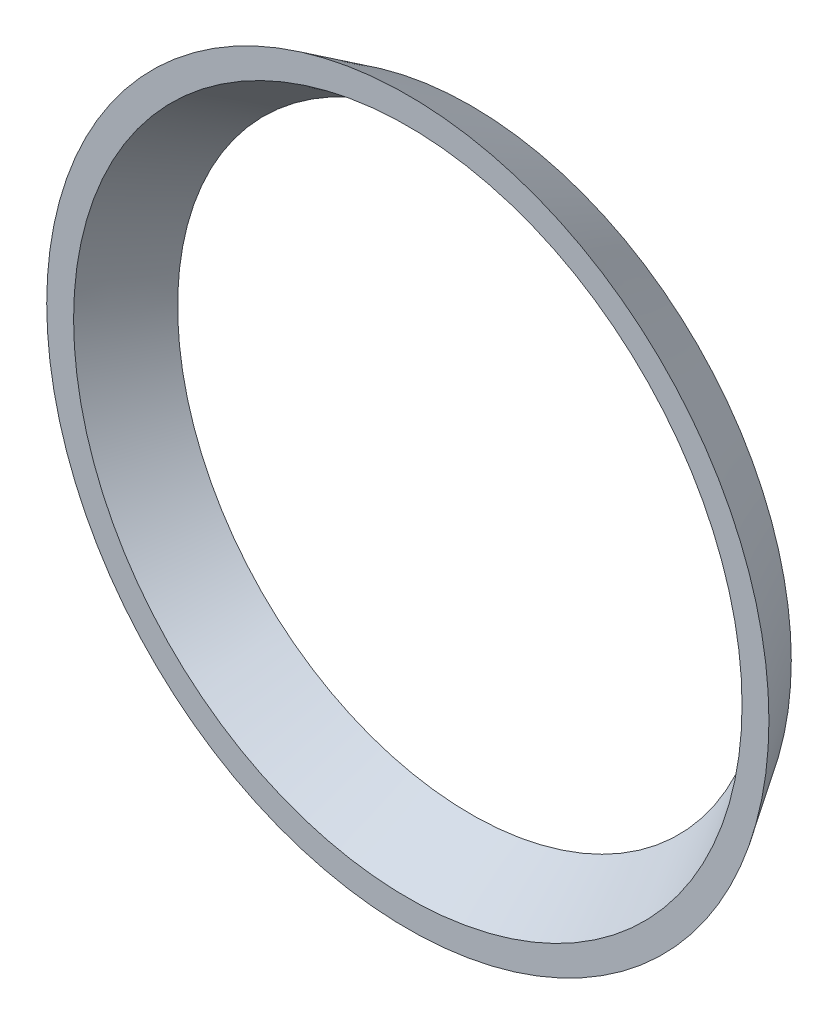
from build123d import *


with BuildPart() as part:
    # Sketch1 → Revolve1 (revolve)
    with BuildSketch(Plane(origin=(0, 0, 0), x_dir=(0, 0, -1), z_dir=(1, 0, 0))):
        Polygon((0, 18.51172162), (3.5, 16.25), (3.5, 17.73827838), (0, 20), align=None)
    revolve(axis=Axis((0, 0, 0), (0, 0, -1)))


solid = part.part
